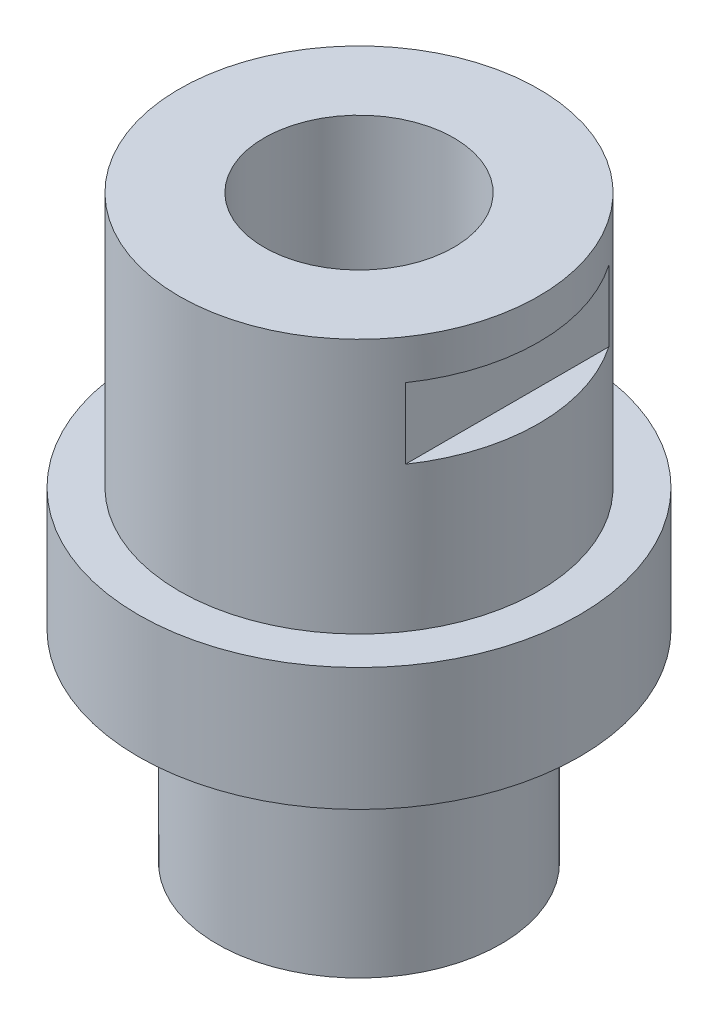
from build123d import *

# Parameters (mm, degrees)
SKETCH1_R            = 35
BOSS_EXTRUDE1_DEPTH  = 92
SKETCH2_OUTSIDE_W    = 99.028
SKETCH2_OUTSIDE_H    = 99.028
SKETCH2_OUTSIDE_R    = 28.5
CUT_EXTRUDE1_DEPTH   = 40.5
SKETCH3_OUTSIDE_W    = 99.028
SKETCH3_OUTSIDE_H    = 99.028
SKETCH3_OUTSIDE_R    = 22.5
CUT_EXTRUDE2_DEPTH   = 32
SKETCH4_R            = 15.05
CUT_EXTRUDE3_DEPTH   = 105.470091414
SKETCH5_W            = 5
SKETCH5_H            = 11.2
TESTINGFEATURE_DEPTH = 105.470091414


with BuildPart() as part:
    # Sketch1 → Boss-Extrude1 (new body)
    with BuildSketch(Plane(origin=(0, 0, 0), x_dir=(1, 0, 0), z_dir=(0, 1, 0))):
        Circle(SKETCH1_R)
    extrude(amount=BOSS_EXTRUDE1_DEPTH)

    # Sketch2 outside → Cut-Extrude1 (cut)
    with BuildSketch(Plane(origin=(0, 92, 0), x_dir=(1, 0, 0), z_dir=(0, 1, 0))):
        Rectangle(SKETCH2_OUTSIDE_W, SKETCH2_OUTSIDE_H)
        Circle(SKETCH2_OUTSIDE_R, mode=Mode.SUBTRACT)
    extrude(amount=-CUT_EXTRUDE1_DEPTH, mode=Mode.SUBTRACT)

    # Sketch3 outside → Cut-Extrude2 (cut)
    with BuildSketch(Plane.XZ):
        Rectangle(SKETCH3_OUTSIDE_W, SKETCH3_OUTSIDE_H)
        Circle(SKETCH3_OUTSIDE_R, mode=Mode.SUBTRACT)
    extrude(amount=-CUT_EXTRUDE2_DEPTH, mode=Mode.SUBTRACT)

    # Sketch4 → Cut-Extrude3 (cut, through all)
    with BuildSketch(Plane.XZ):
        Circle(SKETCH4_R)
    extrude(amount=-CUT_EXTRUDE3_DEPTH, mode=Mode.SUBTRACT)

    # Sketch5 → TestingFeature (cut, symmetric)
    with BuildSketch(Plane.XY):
        with Locations((26, 80.1)):
            Rectangle(SKETCH5_W, SKETCH5_H)
    testingfeature = extrude(amount=TESTINGFEATURE_DEPTH, both=True, mode=Mode.SUBTRACT)

    # Mirror1: TestingFeature across plane
    add(testingfeature.mirror(Plane(origin=(0, 0, 0), x_dir=(0, 0, 1), z_dir=(1, 0, 0))), mode=Mode.SUBTRACT)


solid = part.part
